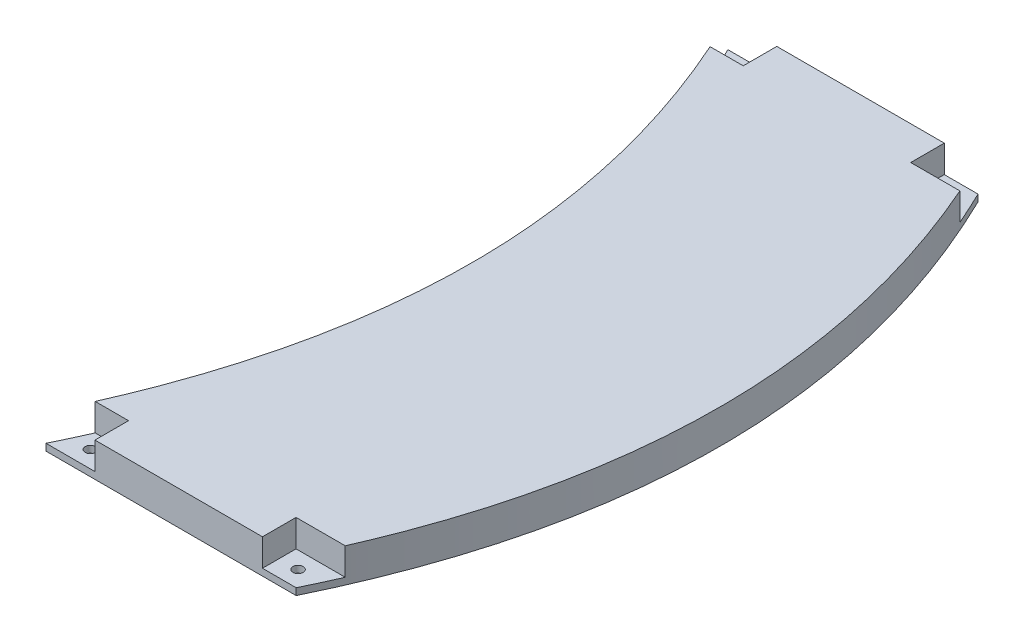
from build123d import *

# Parameters (mm, degrees)
CROQUIS1_W              = 200
CROQUIS1_H              = 200
SALIENTE_EXTRUIR1_DEPTH = 10
CORTAR_EXTRUIR2_DEPTH   = 10
CORTAR_EXTRUIR3_DEPTH   = 8
CROQUIS6_R              = 1.5
CORTAR_EXTRUIR4_DEPTH   = 32
VACIADO1_DEPTH          = 8


# Read off the part's stored shape, not the designer's step: Vaciado1
with BuildPart() as part:
    # Croquis1 → Saliente-Extruir1 (new body)
    with BuildSketch(Plane(origin=(0, 0, 0), x_dir=(1, 0, 0), z_dir=(0, 1, 0))):
        Rectangle(CROQUIS1_W, CROQUIS1_H)
    extrude(amount=SALIENTE_EXTRUIR1_DEPTH)

    # Croquis3 → Cortar-Extruir2 (cut)
    with BuildSketch(Plane(origin=(0, 10, 0), x_dir=(1, 0, 0), z_dir=(0, 1, 0))):
        with BuildLine():
            add(Edge.make_bspline(
                [(-54.658905902, 100), (-5.437672215, 0.742753657), (-54.658905902, -100)],
                knots=[0, 0, 0, 1, 1, 1], degree=2))
            Line((-54.658905902, 100), (-100, 100))
            Line((-100, 100), (-100, -100))
            Line((-100, -100), (-54.658905902, -100))
        make_face()
        with BuildLine():
            Line((100, 100), (18.719386755, 100))
            add(Edge.make_bspline(
                [(18.719386755, 100), (67.218637457, 0), (18.719386755, -100)],
                knots=[0, 0, 0, 1, 1, 1], degree=2))
            Line((18.719386755, -100), (100, -100))
            Line((100, -100), (100, 100))
        make_face()
    extrude(amount=-CORTAR_EXTRUIR2_DEPTH, mode=Mode.SUBTRACT)

    # Croquis4 → Cortar-Extruir3 (cut)
    with BuildSketch(Plane(origin=(0, 10, 0), x_dir=(1, 0, 0), z_dir=(0, 1, 0))):
        Polygon((-50.296578731, -90.149033959), (-40.296578731, -90.149033959), (-40.296578731, -100.149033959), (-50.296578731, -100.149033959), (-58.120283929, -100.149033959), align=None)
        Polygon((8.836094338, -90.149033959), (18.836094338, -90.149033959), (23.704036403, -90.149033959), (18.836094338, -100.149033959), (8.836094338, -100.149033959), align=None)
        Polygon((8.836094338, 90.149033959), (8.836094338, 100.149033959), (18.836094338, 100.149033959), (23.704036403, 90.149033959), (18.836094338, 90.149033959), align=None)
        Polygon((-58.120283929, 100.149033959), (-50.296578731, 90.149033959), (-40.296578731, 90.149033959), (-40.296578731, 100.149033959), (-50.296578731, 100.149033959), align=None)
    extrude(amount=-CORTAR_EXTRUIR3_DEPTH, mode=Mode.SUBTRACT)

    # Croquis6 → Cortar-Extruir4 (cut)
    with BuildSketch(Plane(origin=(0, 2, 0), x_dir=(1, 0, 0), z_dir=(0, 1, 0))):
        with Locations(Location((-46.580021795, -95.07451698, 0), (0, 0, 270))):
            Circle(CROQUIS6_R)
        with Locations(Location((14.358607989, -95.07451698, 0), (0, 0, 270))):
            Circle(CROQUIS6_R)
        with Locations(Location((14.358607989, 95.07451698, 0), (0, 0, 270))):
            Circle(CROQUIS6_R)
        with Locations(Location((-46.580021795, 95.07451698, 0), (0, 0, 270))):
            Circle(CROQUIS6_R)
    extrude(amount=-CORTAR_EXTRUIR4_DEPTH, mode=Mode.SUBTRACT)

    # Vaciado1 outline → Vaciado1 (cut)
    with BuildSketch(Plane(origin=(0, 0, 0), x_dir=(1, 0, 0), z_dir=(0, 1, 0))):
        with BuildLine():
            Line((-38.296578731, 88.149033959), (-46.954714444, 88.14903419))
            add(Edge.make_bspline(
                [(-46.954714444, 88.14903419), (-39.391707249, 70.655852329), (-33.505222898, 53.123612665), (-29.298629275, 35.553220346), (-26.77560099, 17.947129894), (-25.939405083, 0.309621467), (-26.791931975, -17.352344743), (-29.330747185, -35.032202144), (-33.552462911, -52.726080621), (-39.453418895, -70.431901676), (-47.030358691, -88.149034179)],
                knots=[0.063666004, 0.063666004, 0.063666004, 0.063666004, 0.063666004, 0.063666004, 0.063666004, 0.063666004, 0.063666004, 0.063666004, 0.063666004, 0.937249877, 0.937249877, 0.937249877, 0.937249877, 0.937249877, 0.937249877, 0.937249877, 0.937249877, 0.937249877, 0.937249877, 0.937249877], degree=10))
            Line((-47.030358691, -88.149034179), (-38.296578731, -88.149033959))
            Line((-38.296578731, -88.149033959), (-38.296578731, -98))
            Line((-38.296578731, -98), (6.836094338, -98))
            Line((6.836094338, -98), (6.836094338, -88.149033959))
            Line((6.836094338, -88.149033959), (21.949825856, -88.149033757))
            add(Edge.make_bspline(
                [(21.949825856, 88.149033757), (30.411471368, 68.532743192), (36.750179646, 48.933917862), (40.970725224, 29.351479613), (43.07830794, 9.781812592), (43.07830794, -9.781812592), (40.970725224, -29.351479613), (36.750179646, -48.933917862), (30.411471368, -68.532743192), (21.949825856, -88.149033757)],
                knots=[0.055294031, 0.055294031, 0.055294031, 0.055294031, 0.055294031, 0.055294031, 0.055294031, 0.055294031, 0.055294031, 0.055294031, 0.944705969, 0.944705969, 0.944705969, 0.944705969, 0.944705969, 0.944705969, 0.944705969, 0.944705969, 0.944705969, 0.944705969], degree=9))
            Line((21.949825856, 88.149033757), (6.836094338, 88.149033959))
            Line((6.836094338, 88.149033959), (6.836094338, 98))
            Line((6.836094338, 98), (-38.296578731, 98))
            Line((-38.296578731, 98), (-38.296578731, 88.149033959))
        make_face()
    extrude(amount=VACIADO1_DEPTH, mode=Mode.SUBTRACT)


solid = part.part
